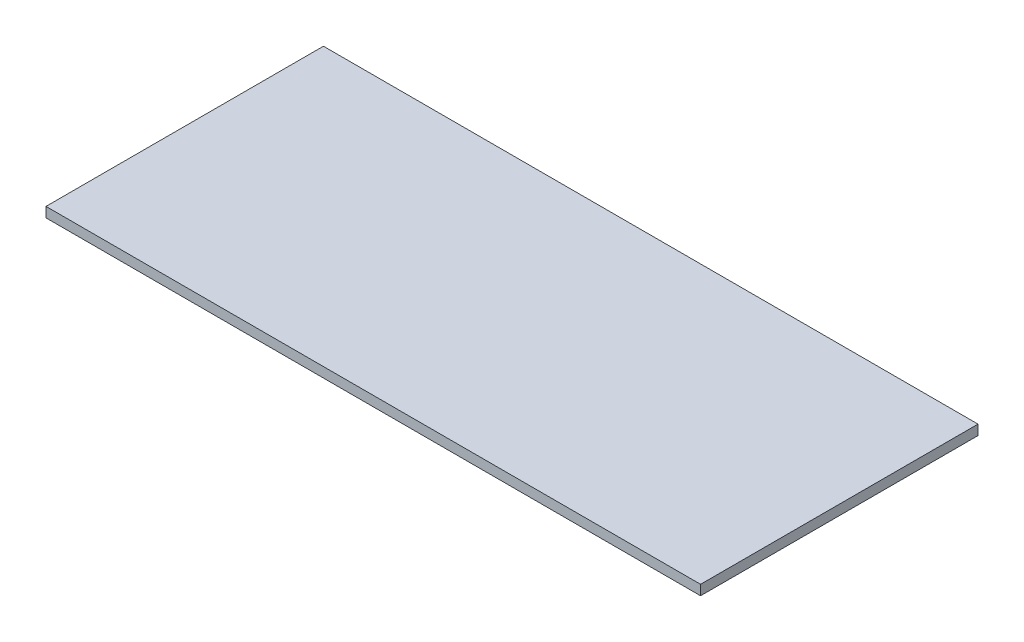
from build123d import *

# Parameters (mm, degrees)
SKETCH_1_W      = 394
SKETCH_1_H      = 167
EXTRUDE_1_DEPTH = 6


with BuildPart() as part:
    # Эскиз1 → Бобышка-Вытянуть1 (new body)
    with BuildSketch(Plane(origin=(0, 0, 0), x_dir=(1, 0, 0), z_dir=(0, 1, 0))):
        with Locations((300, 83.5)):
            Rectangle(SKETCH_1_W, SKETCH_1_H)
    extrude(amount=EXTRUDE_1_DEPTH)


solid = part.part
